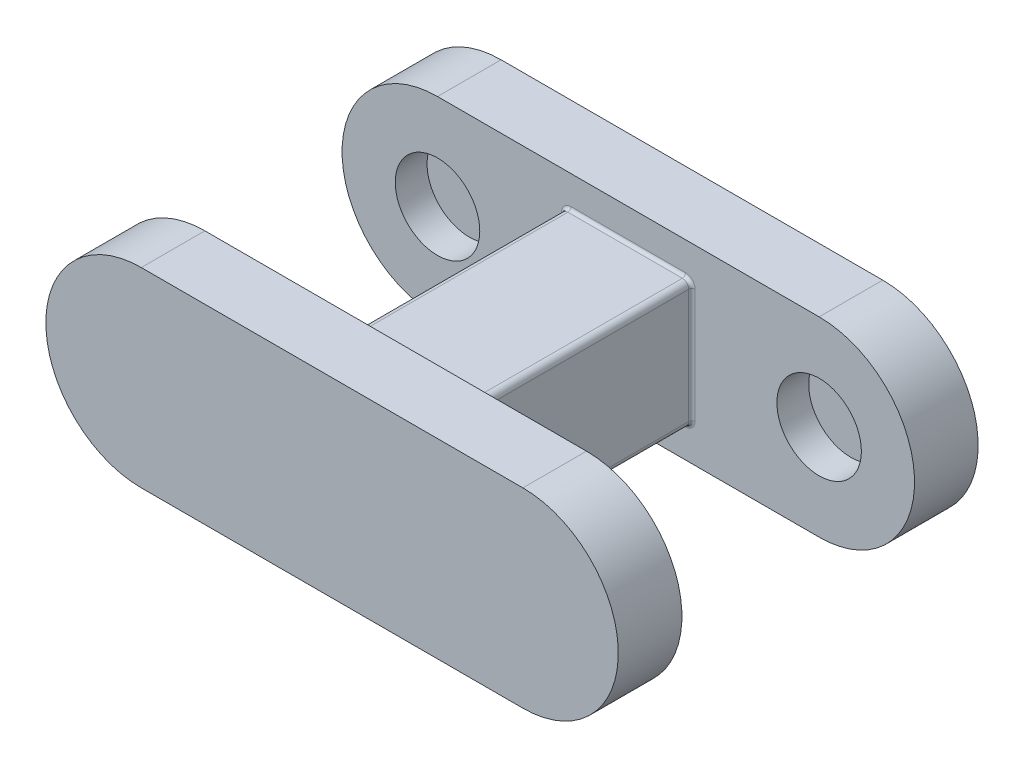
from build123d import *

# Parameters (mm, degrees)
BOSS_EXTRUDE1_DEPTH = 25.4
SKETCH4_R           = 16.875
CUT_EXTRUDE1_DEPTH  = 12.7
SKETCH5_W           = 50.8
SKETCH5_H           = 50.8
BOSS_EXTRUDE2_DEPTH = 92.9
FILLET1_R           = 2.54
FILLET2_R           = 1.27
FILLET3_R           = 1.27


with BuildPart() as part:
    # Sketch1 → Boss-Extrude1 (new body)
    with BuildSketch(Plane.XY):
        with BuildLine():
            Line((-76.2, 38.1), (76.2, 38.1))
            ThreePointArc((76.2, 38.1), (114.3, 0), (76.2, -38.1))
            Line((76.2, -38.1), (-76.2, -38.1))
            ThreePointArc((-76.2, -38.1), (-114.3, 0), (-76.2, 38.1))
        make_face()
    boss_extrude1 = extrude(amount=BOSS_EXTRUDE1_DEPTH)

    # Sketch4 → Cut-Extrude1 (cut)
    with BuildSketch(Plane.XY.offset(25.4)):
        with Locations((76.2, 0)):
            Circle(SKETCH4_R)
        with Locations((-76.2, 0)):
            Circle(SKETCH4_R)
    cut_extrude1 = extrude(amount=-CUT_EXTRUDE1_DEPTH, mode=Mode.SUBTRACT)

    # Sketch5 → Boss-Extrude2 (add)
    with BuildSketch(Plane.XY.offset(25.4)):
        Rectangle(SKETCH5_W, SKETCH5_H)
    extrude(amount=BOSS_EXTRUDE2_DEPTH)

    # Mirror2: Boss-Extrude1, Cut-Extrude1 across plane
    add(boss_extrude1.mirror(Plane.XY.offset(71.85)))
    add(cut_extrude1.mirror(Plane.XY.offset(71.85)), mode=Mode.SUBTRACT)

    # Fillet1
    fillet1_edges = [part.edges().sort_by_distance(p)[0] for p in [
        (25.4, 25.4, 71.85),
        (25.4, -25.4, 71.85),
        (-25.4, -25.4, 71.85),
        (-25.4, 25.4, 71.85),
    ]]
    fillet(fillet1_edges, radius=FILLET1_R)

    # Fillet2
    fillet2_edges = [part.edges().sort_by_distance(p)[0] for p in [
        (-24.656051224, 24.656051224, 25.4),
        (0, 25.4, 25.4),
        (24.656051224, 24.656051224, 25.4),
        (25.4, 0, 25.4),
        (24.656051224, -24.656051224, 25.4),
        (0, -25.4, 25.4),
        (-24.656051224, -24.656051224, 25.4),
        (-25.4, 0, 25.4),
    ]]
    fillet(fillet2_edges, radius=FILLET2_R)

    # Fillet3
    fillet3_edges = [part.edges().sort_by_distance(p)[0] for p in [
        (-24.656051224, 24.656051224, 118.3),
        (0, 25.4, 118.3),
        (24.656051224, 24.656051224, 118.3),
        (25.4, 0, 118.3),
        (24.656051224, -24.656051224, 118.3),
        (0, -25.4, 118.3),
        (-24.656051224, -24.656051224, 118.3),
        (-25.4, 0, 118.3),
    ]]
    fillet(fillet3_edges, radius=FILLET3_R)


solid = part.part
